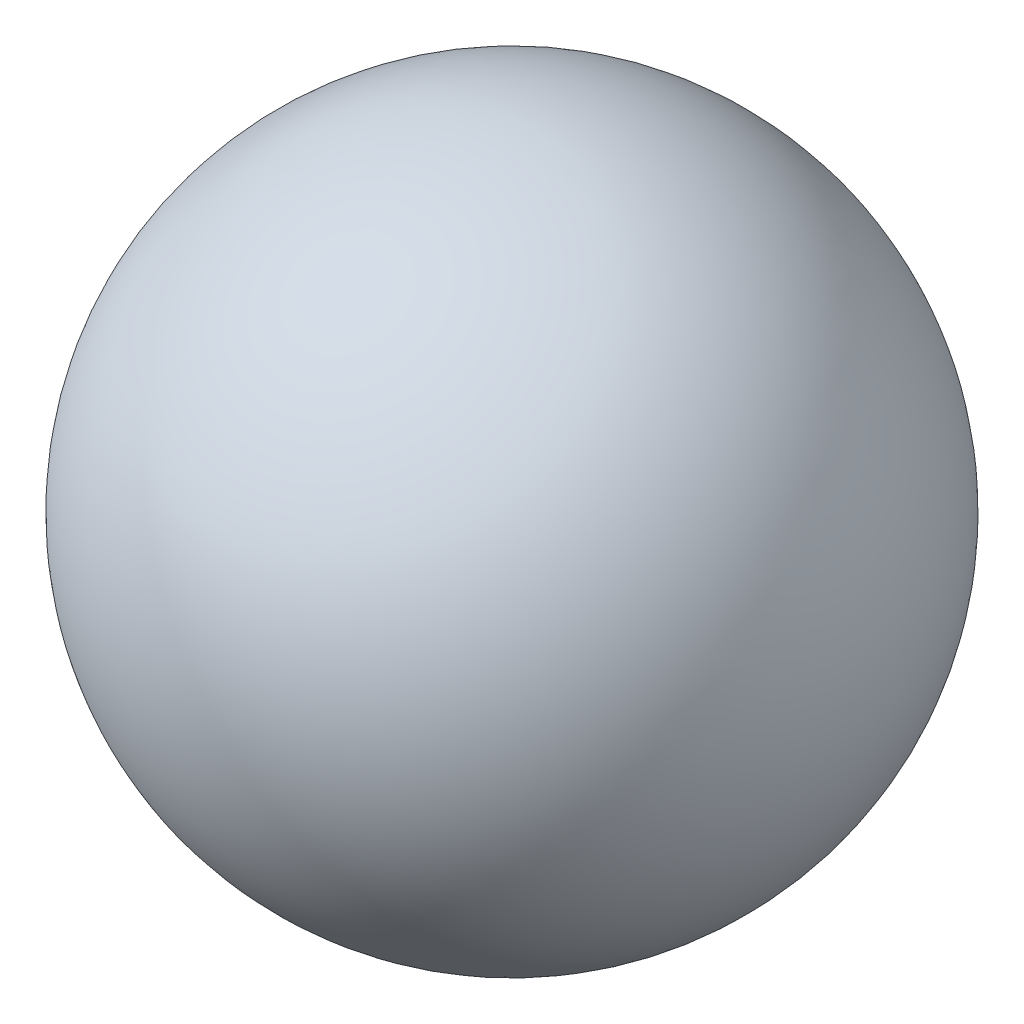
from build123d import *


with BuildPart() as part:
    # 스케치1 → 회전2 (revolve)
    with BuildSketch(Plane(origin=(0, 0, 0), x_dir=(1, 0, 0), z_dir=(0, 1, 0))):
        with BuildLine():
            Line((0, 30), (0, 33.5))
            ThreePointArc((0, 33.5), (-33.5, 0), (0, -33.5))
            Line((0, -33.5), (0, -30))
            ThreePointArc((0, -30), (-30, 0), (0, 30))
        make_face()
    revolve(axis=Axis((0, 0, -33.5), (0, 0, 1)))


solid = part.part
